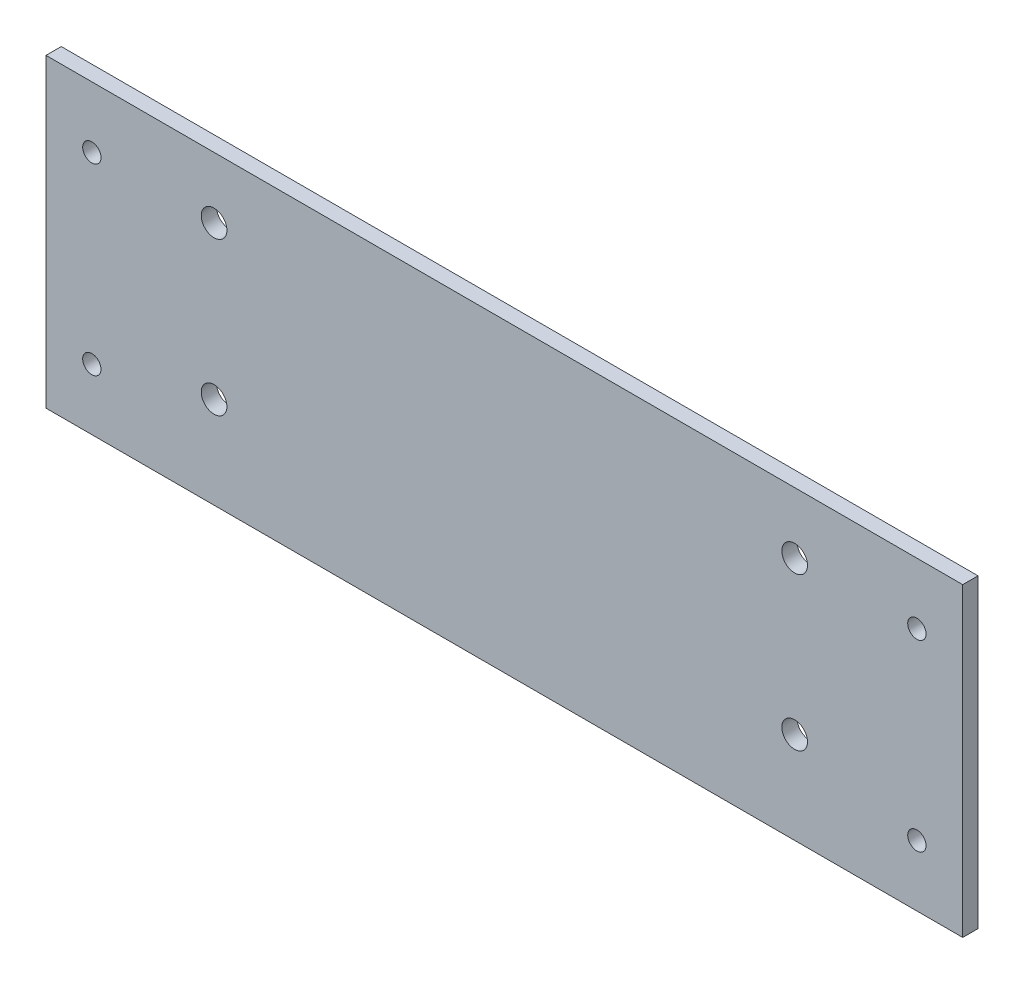
from build123d import *

# Parameters (mm, degrees)
SKETCH1_W           = 150
SKETCH1_H           = 50
BOSS_EXTRUDE1_DEPTH = 2.5
SKETCH2_R           = 1.5
CUT_EXTRUDE1_DEPTH  = 105.051387959
SKETCH3_R           = 2.1
CUT_EXTRUDE2_DEPTH  = 105.051387959


with BuildPart() as part:
    # Sketch1 → Boss-Extrude1 (new body)
    with BuildSketch(Plane.XY):
        with Locations((-19.225888325, 19.067258883)):
            Rectangle(SKETCH1_W, SKETCH1_H)
    extrude(amount=BOSS_EXTRUDE1_DEPTH)

    # Sketch2 → Cut-Extrude1 (cut, through all)
    with BuildSketch(Plane.XY.offset(2.5)):
        with Locations((-86.725888325, 34.067258883)):
            Circle(SKETCH2_R)
        with Locations((-86.725888325, 4.067258883)):
            Circle(SKETCH2_R)
        with Locations((48.274111675, 34.067258883)):
            Circle(SKETCH2_R)
        with Locations((48.274111675, 4.067258883)):
            Circle(SKETCH2_R)
    extrude(amount=-CUT_EXTRUDE1_DEPTH, mode=Mode.SUBTRACT)

    # Sketch3 → Cut-Extrude2 (cut, through all)
    with BuildSketch(Plane.XY.offset(2.5)):
        with Locations((-66.725888325, 34.067258883)):
            Circle(SKETCH3_R)
        with Locations((28.274111675, 34.067258883)):
            Circle(SKETCH3_R)
        with Locations((28.274111675, 9.067258883)):
            Circle(SKETCH3_R)
        with Locations((-66.725888325, 9.067258883)):
            Circle(SKETCH3_R)
    extrude(amount=-CUT_EXTRUDE2_DEPTH, mode=Mode.SUBTRACT)


solid = part.part
